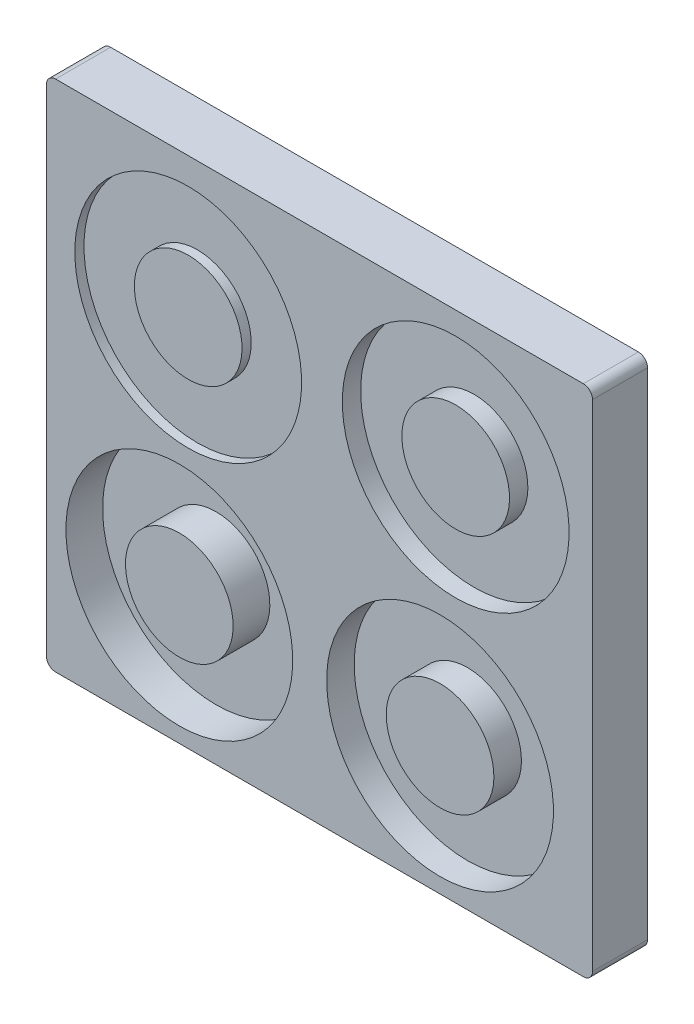
from build123d import *

# Parameters (mm, degrees)
BOSS_EXTRUDE1_DEPTH   = 6
CAVITY1_START         = -3
CAVITY1_OUTLINE_R     = 12.36
CAVITY1_OUTLINE_R_2   = 5.8674
CAVITY1_DEPTH         = 3
CAVITY1_START_2       = -2
CAVITY1_2_OUTLINE_R   = 12.36
CAVITY1_2_OUTLINE_R_2 = 5.8674
CAVITY1_2_DEPTH       = 2
CAVITY1_START_3       = -4
CAVITY1_3_OUTLINE_R   = 12.36
CAVITY1_3_OUTLINE_R_2 = 5.8674
CAVITY1_3_DEPTH       = 1
CAVITY1_START_4       = -1
CAVITY1_4_OUTLINE_R   = 12.36
CAVITY1_4_OUTLINE_R_2 = 5.8674
CAVITY1_4_DEPTH       = 1


# Read off the part's stored shape, not the designer's step: Cavity1
with BuildPart() as part:
    # Sketch1 → Boss-Extrude1 (new body)
    with BuildSketch(Plane.XY):
        with BuildLine():
            Line((-14.454108138, 15.257956391), (43.072620808, 15.257956391))
            ThreePointArc((43.072620808, 15.257956391), (43.77972759, 14.965063172), (44.072620808, 14.257956391))
            Line((44.072620808, 14.257956391), (44.072620808, -39.722776706))
            ThreePointArc((44.072620808, -39.722776706), (43.77972759, -40.429883487), (43.072620808, -40.722776706))
            Line((43.072620808, -40.722776706), (-14.454108138, -40.722776706))
            ThreePointArc((-14.454108138, -40.722776706), (-15.16121492, -40.429883487), (-15.454108138, -39.722776706))
            Line((-15.454108138, -39.722776706), (-15.454108138, 14.257956391))
            ThreePointArc((-15.454108138, 14.257956391), (-15.16121492, 14.965063172), (-14.454108138, 15.257956391))
        make_face()
    extrude(amount=-BOSS_EXTRUDE1_DEPTH)

    # Cavity1 outline → Cavity1 (cut)
    # profile 1 of 2: a face of its own
    with BuildSketch(Plane.XY.offset(CAVITY1_START)):
        with Locations((-0.968104395, -26.708239151)):
            Circle(CAVITY1_OUTLINE_R)
        with Locations((-0.968104395, -26.708239151)):
            Circle(CAVITY1_OUTLINE_R_2, mode=Mode.SUBTRACT)
    # profile 2 of 2: a face of its own
    with BuildSketch(Plane.XY.offset(CAVITY1_START)):
        with Locations((27.453101021, -26.716944952)):
            Circle(CAVITY1_OUTLINE_R)
        with Locations((27.453101021, -26.716944952)):
            Circle(CAVITY1_OUTLINE_R_2, mode=Mode.SUBTRACT)
    extrude(amount=CAVITY1_DEPTH, mode=Mode.SUBTRACT)

    # Cavity1 2 outline → Cavity1 2 (cut)
    with BuildSketch(Plane.XY.offset(CAVITY1_START_2)):
        with Locations((29.157558022, 0.437297786)):
            Circle(CAVITY1_2_OUTLINE_R)
        with Locations((29.157558022, 0.437297786)):
            Circle(CAVITY1_2_OUTLINE_R_2, mode=Mode.SUBTRACT)
    extrude(amount=CAVITY1_2_DEPTH, mode=Mode.SUBTRACT)

    # Cavity1 3 outline → Cavity1 3 (cut)
    with BuildSketch(Plane.XY.offset(CAVITY1_START_3)):
        with Locations((-0.968104395, -26.708239151)):
            Circle(CAVITY1_3_OUTLINE_R)
        with Locations((-0.968104395, -26.708239151)):
            Circle(CAVITY1_3_OUTLINE_R_2, mode=Mode.SUBTRACT)
    extrude(amount=CAVITY1_3_DEPTH, mode=Mode.SUBTRACT)

    # Cavity1 4 outline → Cavity1 4 (cut)
    with BuildSketch(Plane.XY.offset(CAVITY1_START_4)):
        Circle(CAVITY1_4_OUTLINE_R)
        Circle(CAVITY1_4_OUTLINE_R_2, mode=Mode.SUBTRACT)
    extrude(amount=CAVITY1_4_DEPTH, mode=Mode.SUBTRACT)


solid = part.part
